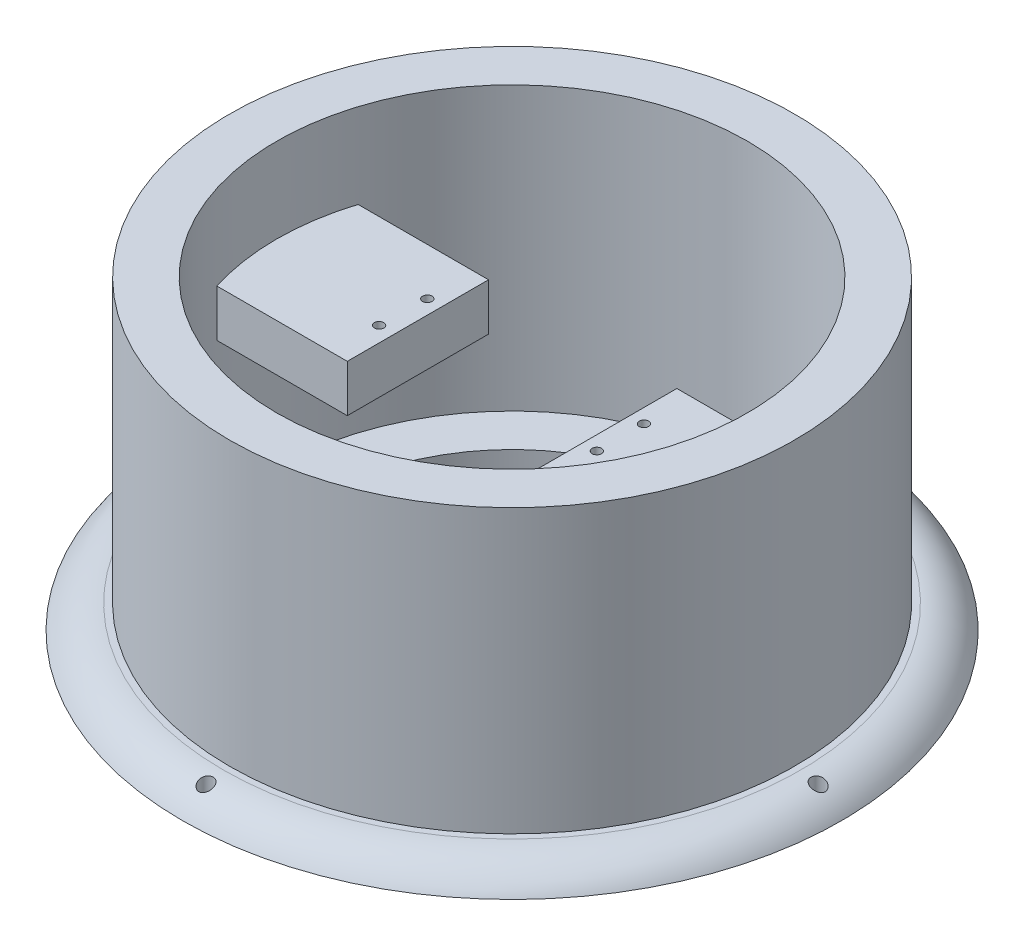
from build123d import *

# Parameters (mm, degrees)
SKETCH1_R                = 60
BOSS_EXTRUDE1_DEPTH      = 60
SHELL1_T                 = -10
SKETCH2_R                = 70
BOSS_EXTRUDE2_DEPTH      = 5
SKETCH5_R                = 40
CUT_EXTRUDE4_DEPTH       = 5
FILLET1_R                = 10
BOSS_EXTRUDE4_DEPTH      = 55
BOSS_EXTRUDE4_DEPTH_BACK = 54
SKETCH7_W                = 30
SKETCH7_H                = 10
SKETCH8_W                = 40
SKETCH8_H                = 32
CUT_EXTRUDE6_DEPTH       = 55
SKETCH9_R                = 1
CUT_EXTRUDE7_DEPTH       = 55
SKETCH10_R               = 1.5
CUT_EXTRUDE8_DEPTH       = 30


with BuildPart() as part:
    # Sketch1 → Boss-Extrude1 (new body)
    with BuildSketch(Plane(origin=(0, 0, 0), x_dir=(1, 0, 0), z_dir=(0, 1, 0))):
        with Locations(Location((0, 0, 0), (0, 0, 270))):
            Circle(SKETCH1_R)
    extrude(amount=BOSS_EXTRUDE1_DEPTH)

    # Shell1
    shell1_openings = [part.faces().sort_by_distance(p)[0] for p in [
        (0, 60, 0),
        (0, 0, 0),
    ]]
    offset(amount=SHELL1_T, openings=shell1_openings, kind=Kind.INTERSECTION)

    # Sketch2 → Boss-Extrude2 (add)
    with BuildSketch(Plane(origin=(0, 0, 0), x_dir=(1, 0, 0), z_dir=(0, 1, 0))):
        with Locations(Location((0, 0, 0), (0, 0, 270))):
            Circle(SKETCH2_R)
    extrude(amount=-BOSS_EXTRUDE2_DEPTH)

    # Sketch5 → Cut-Extrude4 (cut)
    with BuildSketch(Plane(origin=(0, 0, 0), x_dir=(1, 0, 0), z_dir=(0, 1, 0))):
        with Locations(Location((0, 0, 0), (0, 0, 270))):
            Circle(SKETCH5_R)
    extrude(amount=-CUT_EXTRUDE4_DEPTH, mode=Mode.SUBTRACT)

    # Fillet1
    # the kernel refuses this fillet: 10 mm, written as the material it takes off along each edge
    with BuildSketch(Plane(origin=(0, 0, 0), x_dir=(0, 0, 1), z_dir=(-1, 0, 0))) as fillet1_piece_1:
        with BuildLine():
            CenterArc((61.339745962, -10), FILLET1_R, 30, 60)
            Line((61.339745962, 0), (61.339745962, 0.2))
            Line((61.339745962, 0.2), (70, 0.2))
            Line((70, 0.2), (70.2, 0))
            ThreePointArc((70.2, 0), (70.2, -2.5), (70.173205081, -4.9))
            Line((70.173205081, -4.9), (70, -5))
        make_face()
    revolve(axis=Axis((0, 0, 0), (0, 1, 0)), mode=Mode.SUBTRACT)

    # Sketch7 → Boss-Extrude4 (add, two sides: drawn at the far end of the back side and taken through both)
    with BuildSketch(Plane(origin=(0, 0, 0), x_dir=(0, 0, -1), z_dir=(1, 0, 0)).offset(-BOSS_EXTRUDE4_DEPTH_BACK)):
        with Locations((0, 37)):
            Rectangle(SKETCH7_W, SKETCH7_H)
    extrude(amount=BOSS_EXTRUDE4_DEPTH + BOSS_EXTRUDE4_DEPTH_BACK)

    # Sketch8 → Cut-Extrude6 (cut)
    with BuildSketch(Plane(origin=(0, 0, 0), x_dir=(1, 0, 0), z_dir=(0, 1, 0))):
        Rectangle(SKETCH8_W, SKETCH8_H)
    extrude(amount=CUT_EXTRUDE6_DEPTH, mode=Mode.SUBTRACT)

    # Sketch9 → Cut-Extrude7 (cut)
    with BuildSketch(Plane(origin=(0, 0, 0), x_dir=(1, 0, 0), z_dir=(0, 1, 0))):
        with Locations(Location((-23, 5, 0), (0, 0, 90))):
            Circle(SKETCH9_R)
        with Locations(Location((-23.236551587, -5, 0), (0, 0, 90))):
            Circle(SKETCH9_R)
        with Locations(Location((23, 5, 0), (0, 0, 90))):
            Circle(SKETCH9_R)
        with Locations(Location((23, -5, 0), (0, 0, 90))):
            Circle(SKETCH9_R)
    extrude(amount=CUT_EXTRUDE7_DEPTH, mode=Mode.SUBTRACT)

    # Sketch10 → Cut-Extrude8 (cut)
    with BuildSketch(Plane(origin=(0, 0, 0), x_dir=(1, 0, 0), z_dir=(0, 1, 0))):
        with Locations(Location((0, 65, 0), (0, 0, 270))):
            Circle(SKETCH10_R)
        with Locations(Location((65, 0, 0), (0, 0, 270))):
            Circle(SKETCH10_R)
        with Locations(Location((0, -65, 0), (0, 0, 270))):
            Circle(SKETCH10_R)
        with Locations(Location((-65, 0, 0), (0, 0, 270))):
            Circle(SKETCH10_R)
    extrude(amount=-CUT_EXTRUDE8_DEPTH, mode=Mode.SUBTRACT)


solid = part.part
